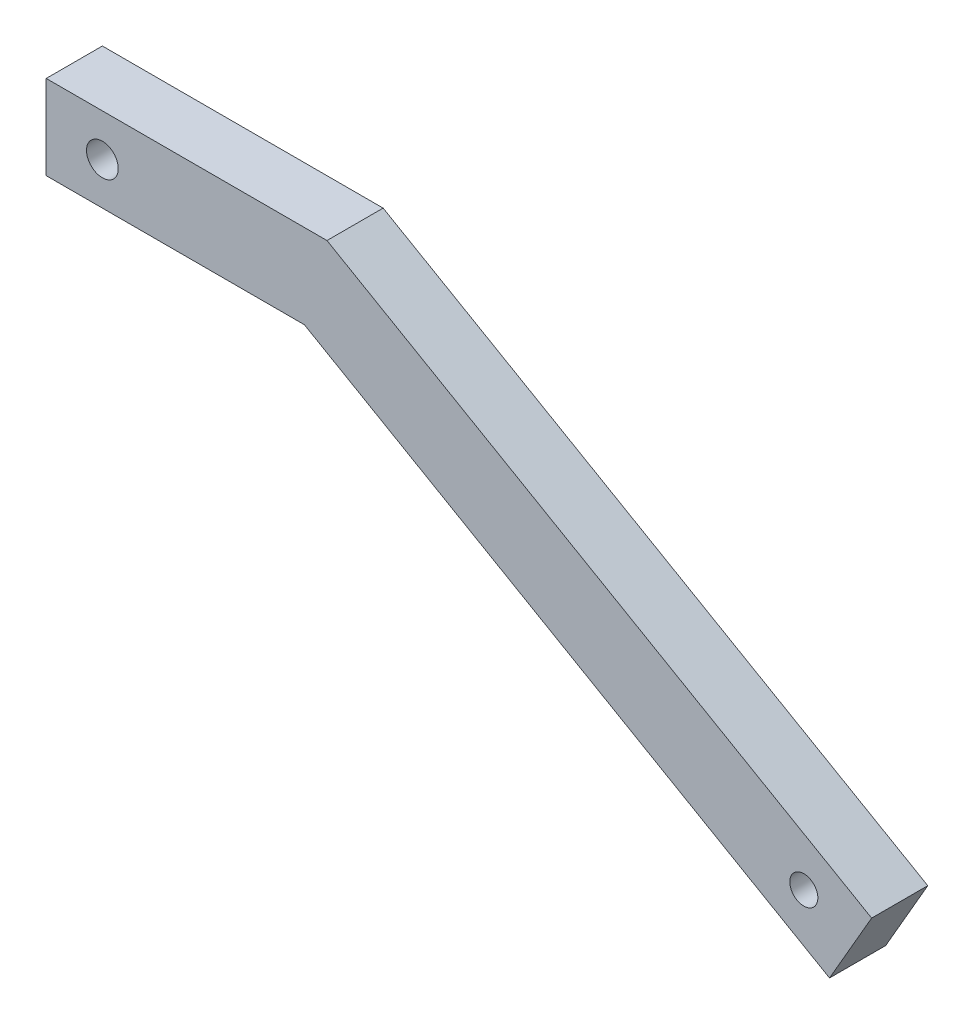
from build123d import *

# Parameters (mm, degrees)
BASE_FLANGE1_START = -10
BASE_FLANGE1_DEPTH = 10
CUT_EXTRUDE1_REACH = 164.687
SKETCH6_R          = 2.823671173
SKETCH6_R_2        = 2.5


# Read off the part's stored shape, not the designer's step: Base-Flange1
with BuildPart() as part:
    # Base-Flange1 outline → Base-Flange1 (new body)
    with BuildSketch(Plane.XY.offset(BASE_FLANGE1_START)):
        Polygon((50, 0), (0, 0), (0, -15), (45.980762114, -15), (139.494845224, -68.990381057), (146.994845224, -56), align=None)
    extrude(amount=BASE_FLANGE1_DEPTH)

    # Sketch6 → Cut-Extrude1 (cut, up to next)
    with BuildSketch(Plane.XY, mode=Mode.PRIVATE) as cut_extrude1_sk1:
        with Locations((10, -7.5)):
            Circle(SKETCH6_R)
    cut_extrude1_tool1 = extrude(cut_extrude1_sk1.sketch, amount=-CUT_EXTRUDE1_REACH, mode=Mode.PRIVATE) & part.part
    # Sketch6 → Cut-Extrude1 (cut, up to next)
    with BuildSketch(Plane.XY, mode=Mode.PRIVATE) as cut_extrude1_sk2:
        with Locations((134.915511346, -57.686247372)):
            Circle(SKETCH6_R_2)
    cut_extrude1_tool2 = extrude(cut_extrude1_sk2.sketch, amount=-CUT_EXTRUDE1_REACH, mode=Mode.PRIVATE) & part.part
    add(cut_extrude1_tool1.solids().sort_by_distance((10, -7.5, 0))[0], mode=Mode.SUBTRACT)
    add(cut_extrude1_tool2.solids().sort_by_distance((134.915511, -57.686247, 0))[0], mode=Mode.SUBTRACT)


solid = part.part
